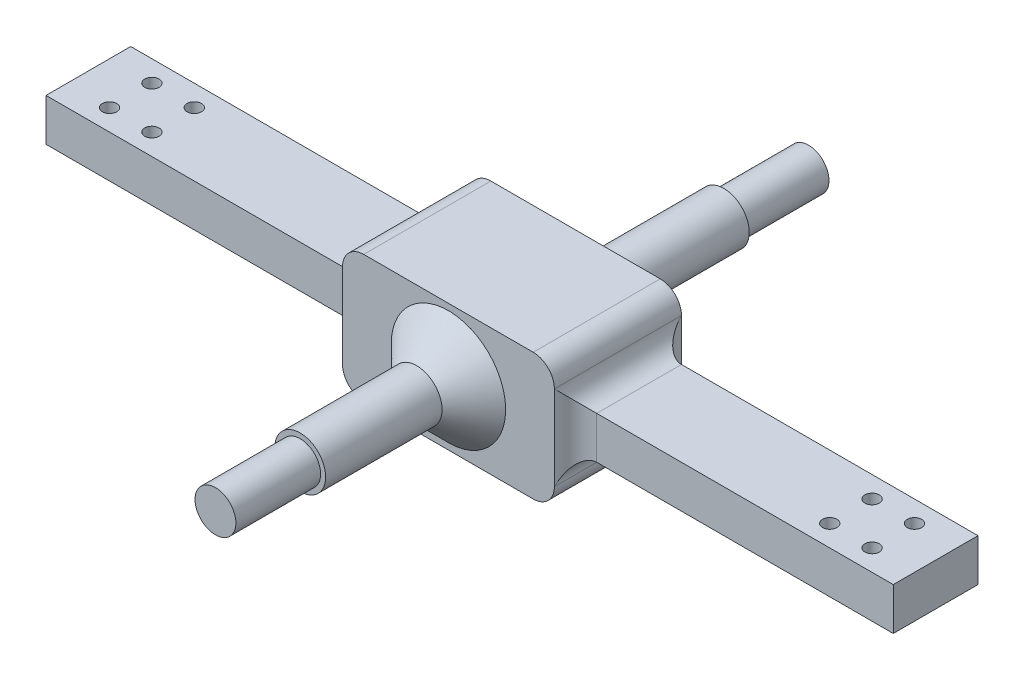
from build123d import *

# Parameters (mm, degrees)
SKETCH1_W            = 200
SKETCH1_H            = 20
BOSS_EXTRUDE1_DEPTH  = 5
SKETCH2_W            = 50
SKETCH2_H            = 30
BOSS_EXTRUDE2_DEPTH  = 15
FILLET3_R            = 5
SKETCH3_R            = 6
BOSS_EXTRUDE3_DEPTH  = 50
CHAMFER1_SIZE        = 7.5
M3_CLEARANCE_HOLE1_D = 3.4
SKETCH19_R           = 4.825
BOSS_EXTRUDE4_DEPTH  = 20
BOSS_EXTRUDE5_START  = 20
SKETCH20_R           = 4.825
BOSS_EXTRUDE5_DEPTH  = 20


with BuildPart() as part:
    # Sketch1 → Boss-Extrude1 (new, symmetric)
    with BuildSketch(Plane(origin=(0, 0, 0), x_dir=(1, 0, 0), z_dir=(0, 1, 0))):
        Rectangle(SKETCH1_W, SKETCH1_H)
    extrude(amount=BOSS_EXTRUDE1_DEPTH, both=True)

    # Sketch2 → Boss-Extrude2 (add, symmetric)
    with BuildSketch(Plane.XY):
        Rectangle(SKETCH2_W, SKETCH2_H)
    extrude(amount=BOSS_EXTRUDE2_DEPTH, both=True)

    # Fillet3
    fillet3_edges = [part.edges().sort_by_distance(p)[0] for p in [
        (-25, -5, 0),
        (25, -5, 0),
        (25, -15, 0),
        (25, 0, 10),
        (25, 5, 0),
        (25, 0, -10),
        (-25, 15, 0),
        (-25, 0, -10),
        (-25, 5, 0),
        (-25, 0, 10),
        (25, 15, 0),
        (-25, -15, 0),
    ]]
    fillet(fillet3_edges, radius=FILLET3_R - 0.0001)  # a hair under: the kernel refuses the full size

    # Sketch3 → Boss-Extrude3 (add, symmetric)
    with BuildSketch(Plane.XY):
        with Locations(Location((0, 0, 0), (0, 0, 180))):
            Circle(SKETCH3_R)
    extrude(amount=BOSS_EXTRUDE3_DEPTH, both=True)

    # Chamfer1
    chamfer1_edges = [part.edges().sort_by_distance(p)[0] for p in [
        (6, 0, 15),
        (6, 0, -15),
    ]]
    chamfer(chamfer1_edges, length=CHAMFER1_SIZE)

    # M3 Clearance Hole1 (through all)
    with Locations(Plane(origin=(0, 5, 0), x_dir=(1, 0, 0), z_dir=(0, 1, 0))):
        with Locations((-90, 5), (-90, -5), (90, -5), (90, 5), (-80, 5), (-80, -5), (80, 5), (80, -5)):
            Hole(M3_CLEARANCE_HOLE1_D / 2)

    # Sketch19 → Boss-Extrude4 (add)
    with BuildSketch(Plane(origin=(0, 0, -50), x_dir=(-1, 0, 0), z_dir=(0, 0, -1))):
        Circle(SKETCH19_R)
    extrude(amount=BOSS_EXTRUDE4_DEPTH)

    # Sketch20 → Boss-Extrude5 (add)
    with BuildSketch(Plane.XY.offset(50).offset(BOSS_EXTRUDE5_START)):
        with Locations(Location((0, 0, 0), (0, 0, 180))):
            Circle(SKETCH20_R)
    extrude(amount=-BOSS_EXTRUDE5_DEPTH)


solid = part.part
